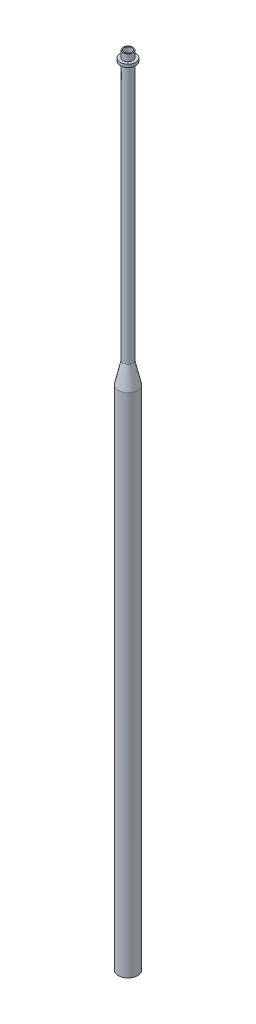
from build123d import *

# Parameters (mm, degrees)
ESQUISSE1_R             = 5
BOSS_EXTRU_1_DEPTH      = 820
ESQUISSE2_R             = 10
BOSS_EXTRU_2_DEPTH      = 500
CHANFREIN1_SIZE         = 10
CHANFREIN1_SIZE_2       = 43.314758743
ESQUISSE3_R             = 4
ENL_V_MAT_EXTRU_1_DEPTH = 821.121942153
ESQUISSE4_R             = 8
ESQUISSE4_R_2           = 4.5
BOSS_EXTRU_3_DEPTH      = 3


with BuildPart() as part:
    # Esquisse1 → Boss.-Extru.1 (new body)
    with BuildSketch(Plane(origin=(0, 0, 0), x_dir=(1, 0, 0), z_dir=(0, 1, 0))):
        with Locations(Location((0, 0, 0), (0, 0, 270))):
            Circle(ESQUISSE1_R)
    extrude(amount=BOSS_EXTRU_1_DEPTH)

    # Esquisse2 → Boss.-Extru.2 (add)
    with BuildSketch(Plane(origin=(0, 0, 0), x_dir=(1, 0, 0), z_dir=(0, 1, 0))):
        with Locations(Location((0, 0, 0), (0, 0, 270))):
            Circle(ESQUISSE2_R)
    extrude(amount=BOSS_EXTRU_2_DEPTH)

    # Chanfrein1
    # the kernel refuses this chamfer: 43.314758743, 10 mm, written as the material it adds along each edge
    with BuildSketch(Plane(origin=(0, 500, 0), x_dir=(0, 0, 1), z_dir=(1, 0, 0))) as chanfrein1_piece_1_section:
        Polygon((5 + CHANFREIN1_SIZE, 0), (5, -CHANFREIN1_SIZE_2), (5, 0), align=None)
    chanfrein1_piece_1 = revolve(axis=Axis((0, 500, 0), (0, -1, 0)), mode=Mode.PRIVATE)
    chanfrein1_piece_1 = chanfrein1_piece_1 & Plane(origin=(0, 533.283833366, 0), x_dir=(0, 0, 1), z_dir=(0, -1, 0)) * Cylinder(10, 174, mode=Mode.PRIVATE)
    add(chanfrein1_piece_1)

    # Esquisse3 → Enlèv. mat.-Extru.1 (cut, through all)
    with BuildSketch(Plane(origin=(0, 820, 0), x_dir=(1, 0, 0), z_dir=(0, 1, 0))):
        with Locations(Location((0, 0, 0), (0, 0, 270))):
            Circle(ESQUISSE3_R)
    extrude(amount=-ENL_V_MAT_EXTRU_1_DEPTH, mode=Mode.SUBTRACT)

    # Esquisse4 → Boss.-Extru.3 (add)
    with BuildSketch(Plane(origin=(0, 810, 0), x_dir=(1, 0, 0), z_dir=(0, 1, 0))):
        with Locations(Location((0, 0, 0), (0, 0, 270))):
            Circle(ESQUISSE4_R)
        Circle(ESQUISSE4_R_2, mode=Mode.SUBTRACT)
    extrude(amount=BOSS_EXTRU_3_DEPTH)


solid = part.part
